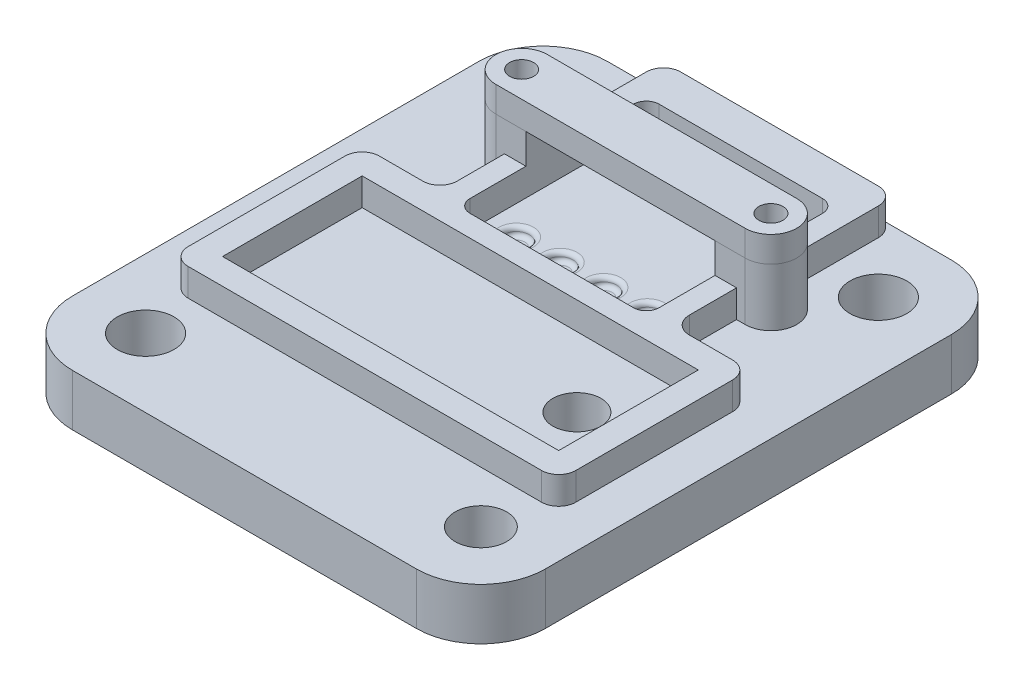
from build123d import *
from build123d.topology import SkipClean

# Parameters (mm, degrees)
SKETCH1_W              = 22.55
SKETCH1_H              = 11.12
SKETCH1_W_2            = 19.55
SKETCH1_H_2            = 8.12
BOSS_EXTRUDE1_DEPTH    = 1
SKETCH2_W              = 13.5
SKETCH2_H              = 13.5
SKETCH2_W_2            = 10.5
SKETCH2_H_2            = 10.5
BOSS_EXTRUDE2_DEPTH    = 1
SKETCH3_R              = 1.65
SKETCH3_R_2            = 1.5
SKETCH3_W              = 16.525
SKETCH3_H              = 8.12
SKETCH3_W_2            = 3.025
SKETCH3_W_3            = 10.5
SKETCH3_H_2            = 10.5
BOSS_EXTRUDE3_DEPTH    = 2
FILLET1_R              = 2.75
FILLET2_R              = 0.5
BOSS_EXTRUDE4_DEPTH    = 1
DELETEFACE1_DEPTH      = 1
SKETCH5_R              = 0.7
BOSS_EXTRUDE5_DEPTH    = 2.35
MOVE_START             = 1
MOVE_FACE1_OUTLINE_W   = 19.55
MOVE_FACE1_OUTLINE_H   = 8.12
MOVE_FACE1_DEPTH       = 0.6
SKETCH6_R              = 0.7
BOSS_EXTRUDE6_DEPTH    = 1.5
MOVE_FACE2_DEPTH       = 3.35
SKETCH7_R              = 1.5
CUT_EXTRUDE1_DEPTH     = 10
MOVE_FACE3_BY          = 0.1
MOVE_START_2           = -2
MOVE_FACE4_DEPTH       = 2
MOVE_FACE4_2_OUTLINE_W = 13.5
MOVE_FACE4_2_OUTLINE_H = 1
MOVE_FACE4_2_DEPTH     = 1.6
MOVE_START_3           = -3
MOVE_FACE5_OUTLINE_R   = 1.65
MOVE_FACE5_OUTLINE_R_2 = 1.5
MOVE_FACE5_OUTLINE_R_3 = 1.4
MOVE_FACE5_DEPTH       = 1
MOVE_START_4           = -1.5
MOVE_FACE6_OUTLINE_R   = 0.7
MOVE_FACE6_DEPTH       = 1.5
FILLET3_R              = 1
SKETCH8_R              = 0.75
CUT_EXTRUDE2_DEPTH     = 0.5
FILLET4_R              = 0.25


# Read off the part's stored shape, not the designer's step: DeleteFace1, Move Face1, Move Face2, Move Face4, Move Face5, Move Face6
# Some blends are built 0.0001 mm under size
with BuildPart() as part:
    # Sketch1 → Boss-Extrude1 (new body)
    with BuildSketch(Plane(origin=(0, 0, 0), x_dir=(1, 0, 0), z_dir=(0, 1, 0))):
        with Locations((9.525, 3.81)):
            Rectangle(SKETCH1_W, SKETCH1_H)
        with Locations((9.525, 3.81)):
            Rectangle(SKETCH1_W_2, SKETCH1_H_2, mode=Mode.SUBTRACT)
    extrude(amount=BOSS_EXTRUDE1_DEPTH)

    # Sketch2 → Boss-Extrude2 (add)
    with BuildSketch(Plane(origin=(0, 1, 0), x_dir=(1, 0, 0), z_dir=(0, 1, 0))):
        with Locations((9.525, 14.62)):
            Rectangle(SKETCH2_W, SKETCH2_H)
        with Locations((9.525, 14.62)):
            Rectangle(SKETCH2_W_2, SKETCH2_H_2, mode=Mode.SUBTRACT)
    extrude(amount=-BOSS_EXTRUDE2_DEPTH)

    # Sketch3 → Boss-Extrude3 (add)
    # profile 1 of 8: a face of its own
    with BuildSketch(Plane.XZ):
        with BuildLine():
            Line((-1.75, -9.37), (-1.75, 1.75))
            Line((-1.75, 1.75), (16.275, 1.75))
            Line((16.275, 1.75), (20.8, 1.75))
            Line((20.8, 1.75), (20.8, -9.37))
            Line((20.8, -9.37), (20.8, -17.74002))
            ThreePointArc((20.8, -17.74002), (20.893448, -18.048869), (20.925, -18.37))
            ThreePointArc((20.925, -18.37), (20.893448, -18.691131), (20.8, -18.99998))
            Line((20.8, -18.99998), (20.8, -21.37))
            Line((20.8, -21.37), (22.275, -21.37))
            Line((22.275, -21.37), (22.275, 7.75))
            Line((22.275, 7.75), (-3.225, 7.75))
            Line((-3.225, 7.75), (-3.225, -21.37))
            Line((-3.225, -21.37), (-1.75, -21.37))
            Line((-1.75, -21.37), (-1.75, -18.99998))
            ThreePointArc((-1.75, -18.99998), (-1.875, -18.37), (-1.75, -17.74002))
            Line((-1.75, -17.74002), (-1.75, -9.37))
        make_face()
        with Locations(Location((-0.225, 4.75, 0), (0, 0, 270))):
            Circle(SKETCH3_R, mode=Mode.SUBTRACT)
        with Locations(Location((19.275, 4.75, 0), (0, 0, 270))):
            Circle(SKETCH3_R_2, mode=Mode.SUBTRACT)
    # profile 2 of 8: a face of its own
    with BuildSketch(Plane.XZ):
        with Locations((8.0125, -3.81)):
            Rectangle(SKETCH3_W, SKETCH3_H)
    # profile 3 of 8: a face of its own
    with BuildSketch(Plane.XZ):
        Polygon((20.8, 1.75), (16.275, 1.75), (16.275, 0.25), (19.3, 0.25), (19.3, -7.87), (16.275, -7.87), (16.275, -9.37), (20.8, -9.37), align=None)
    # profile 4 of 8: a face of its own
    with BuildSketch(Plane.XZ):
        with Locations((17.7875, -3.81)):
            Rectangle(SKETCH3_W_2, SKETCH3_H)
    # profile 5 of 8: a face of its own
    with BuildSketch(Plane.XZ):
        with BuildLine():
            Line((2.775, -9.37), (-1.75, -9.37))
            Line((-1.75, -9.37), (-1.75, -17.74002))
            ThreePointArc((-1.75, -17.74002), (0.096131, -16.751552), (1.425, -18.37))
            ThreePointArc((1.425, -18.37), (0.096131, -19.988448), (-1.75, -18.99998))
            Line((-1.75, -18.99998), (-1.75, -21.37))
            Line((-1.75, -21.37), (2.775, -21.37))
            Line((2.775, -21.37), (2.775, -9.37))
        make_face()
    # profile 6 of 8: a face of its own
    with BuildSketch(Plane.XZ):
        Polygon((16.275, 1.75), (-1.75, 1.75), (-1.75, -9.37), (2.775, -9.37), (2.775, -21.37), (16.275, -21.37), (16.275, -9.37), (16.275, -7.87), (-0.25, -7.87), (-0.25, 0.25), (16.275, 0.25), align=None)
        with Locations((9.525, -14.62)):
            Rectangle(SKETCH3_W_3, SKETCH3_H_2, mode=Mode.SUBTRACT)
    # profile 7 of 8: a face of its own
    with BuildSketch(Plane.XZ):
        with Locations((9.525, -14.62)):
            Rectangle(SKETCH3_W_3, SKETCH3_H_2)
    # profile 8 of 8: a face of its own
    with BuildSketch(Plane.XZ):
        with BuildLine():
            Line((20.8, -17.74002), (20.8, -9.37))
            Line((20.8, -9.37), (16.275, -9.37))
            Line((16.275, -9.37), (16.275, -21.37))
            Line((16.275, -21.37), (20.8, -21.37))
            Line((20.8, -21.37), (20.8, -18.99998))
            ThreePointArc((20.8, -18.99998), (17.625, -18.37), (20.8, -17.74002))
        make_face()
    extrude(amount=BOSS_EXTRUDE3_DEPTH)

    # Fillet1
    fillet1_edges = [part.edges().sort_by_distance(p)[0] for p in [
        (-3.225, -1, 7.75),
        (-3.225, -1, -21.37),
        (22.275, -1, -21.37),
        (22.275, -1, 7.75),
    ]]
    fillet(fillet1_edges, radius=FILLET1_R)

    # Fillet2
    fillet2_edges = [part.edges().sort_by_distance(p)[0] for p in [
        (4.275, 0.5, -19.87),
        (14.775, 0.5, -19.87),
        (14.775, 0.5, -9.37),
        (4.275, 0.5, -9.37),
    ]]
    fillet(fillet2_edges, radius=FILLET2_R)

    # Sketch4 → Boss-Extrude4 (add)
    with BuildSketch(Plane(origin=(0, 0, 0), x_dir=(1, 0, 0), z_dir=(0, 1, 0))):
        with BuildLine():
            Line((16.275, 16.12), (16.275, 15.109898))
            ThreePointArc((16.275, 15.109898), (17.039575, 15.268074), (17.475, 14.62))
            ThreePointArc((17.475, 14.62), (17.039575, 13.971926), (16.275, 14.130102))
            Line((16.275, 14.130102), (16.275, 13.12))
            Line((16.275, 13.12), (16.775, 13.12))
            ThreePointArc((16.775, 13.12), (18.275, 14.62), (16.775, 16.12))
            Line((16.775, 16.12), (16.275, 16.12))
        make_face()
        with BuildLine():
            Line((2.775, 15.109898), (2.775, 16.12))
            Line((2.775, 16.12), (2.275, 16.12))
            ThreePointArc((2.275, 16.12), (0.775, 14.62), (2.275, 13.12))
            Line((2.275, 13.12), (2.775, 13.12))
            Line((2.775, 13.12), (2.775, 14.130102))
            ThreePointArc((2.775, 14.130102), (1.575, 14.62), (2.775, 15.109898))
        make_face()
    extrude(amount=BOSS_EXTRUDE4_DEPTH)

    # DeleteFace1 outline → DeleteFace1 (cut)
    with BuildSketch(Plane(origin=(0, 0, 0), x_dir=(1, 0, 0), z_dir=(0, 1, 0))):
        with BuildLine():
            ThreePointArc((2.775, 14.130102), (2.975, 14.62), (2.775, 15.109898))
            Line((2.775, 15.109898), (2.775, 14.130102))
        make_face()
        with BuildLine():
            Line((16.275, 14.130102), (16.275, 15.109898))
            ThreePointArc((16.275, 15.109898), (16.075, 14.62), (16.275, 14.130102))
        make_face()
    extrude(amount=DELETEFACE1_DEPTH, mode=Mode.SUBTRACT)

    # Sketch5 → Boss-Extrude5 (add)
    # profile 1 of 2: a face of its own
    with SkipClean():  # the faces are left unmerged after this step: merging them gives an invalid solid
        with BuildSketch(Plane(origin=(0, 1, 0), x_dir=(1, 0, 0), z_dir=(0, 1, 0))):
            with BuildLine():
                Line((4.275, 16.12), (4.275, 13.12))
                Line((4.275, 13.12), (2.275, 13.12))
                ThreePointArc((2.275, 13.12), (0.775, 14.62), (2.275, 16.12))
                Line((2.275, 16.12), (4.275, 16.12))
            make_face()
            with Locations(Location((2.275, 14.62, 0), (0, 0, 270))):
                Circle(SKETCH5_R, mode=Mode.SUBTRACT)
        # profile 2 of 2: a face of its own
        with BuildSketch(Plane(origin=(0, 1, 0), x_dir=(1, 0, 0), z_dir=(0, 1, 0))):
            with BuildLine():
                Line((14.775, 13.12), (14.775, 16.12))
                Line((14.775, 16.12), (16.775, 16.12))
                ThreePointArc((16.775, 16.12), (18.275, 14.62), (16.775, 13.12))
                Line((16.775, 13.12), (14.775, 13.12))
            make_face()
            with Locations(Location((16.775, 14.62, 0), (0, 0, 270))):
                Circle(SKETCH5_R, mode=Mode.SUBTRACT)
        extrude(amount=BOSS_EXTRUDE5_DEPTH)

    # Move Face1 outline → Move Face1 (add)
    # profile 1 of 2: a face of its own
    with SkipClean():  # the faces are left unmerged after this step: merging them gives an invalid solid
        with BuildSketch(Plane(origin=(0, 0, 0), x_dir=(1, 0, 0), z_dir=(0, 1, 0)).offset(MOVE_START)):
            with BuildLine():
                Line((14.775, 16.12), (16.275, 16.12))
                Line((16.275, 16.12), (16.275, 21.37))
                Line((16.275, 21.37), (2.775, 21.37))
                Line((2.775, 21.37), (2.775, 16.12))
                Line((2.775, 16.12), (4.275, 16.12))
                Line((4.275, 16.12), (4.275, 19.37))
                ThreePointArc((4.275, 19.37), (4.421447, 19.723553), (4.775, 19.87))
                Line((4.775, 19.87), (14.275, 19.87))
                ThreePointArc((14.275, 19.87), (14.628553, 19.723553), (14.775, 19.37))
                Line((14.775, 19.37), (14.775, 16.12))
            make_face()
        # profile 2 of 2: a face of its own
        with BuildSketch(Plane(origin=(0, 0, 0), x_dir=(1, 0, 0), z_dir=(0, 1, 0)).offset(MOVE_START)):
            with BuildLine():
                Line((16.275, 13.12), (14.775, 13.12))
                Line((14.775, 13.12), (14.775, 9.87))
                ThreePointArc((14.775, 9.87), (14.628553, 9.516447), (14.275, 9.37))
                Line((14.275, 9.37), (4.775, 9.37))
                ThreePointArc((4.775, 9.37), (4.421447, 9.516447), (4.275, 9.87))
                Line((4.275, 9.87), (4.275, 13.12))
                Line((4.275, 13.12), (2.775, 13.12))
                Line((2.775, 13.12), (2.775, 9.37))
                Line((2.775, 9.37), (-1.75, 9.37))
                Line((-1.75, 9.37), (-1.75, -1.75))
                Line((-1.75, -1.75), (20.8, -1.75))
                Line((20.8, -1.75), (20.8, 9.37))
                Line((20.8, 9.37), (16.275, 9.37))
                Line((16.275, 9.37), (16.275, 13.12))
            make_face()
            with Locations((9.525, 3.81)):
                Rectangle(MOVE_FACE1_OUTLINE_W, MOVE_FACE1_OUTLINE_H, mode=Mode.SUBTRACT)
        extrude(amount=MOVE_FACE1_DEPTH)

    # Move Face2 outline → Move Face2 (cut)
    with SkipClean():  # the faces are left unmerged after this step: merging them gives an invalid solid
        with BuildSketch(Plane(origin=(0, 0, 0), x_dir=(1, 0, 0), z_dir=(0, 1, 0))):
            with BuildLine():
                Line((4.775, 9.12), (14.275, 9.12))
                ThreePointArc((14.275, 9.12), (14.80533, 9.33967), (15.025, 9.87))
                Line((15.025, 9.87), (15.025, 19.37))
                ThreePointArc((15.025, 19.37), (14.80533, 19.90033), (14.275, 20.12))
                Line((14.275, 20.12), (4.775, 20.12))
                ThreePointArc((4.775, 20.12), (4.24467, 19.90033), (4.025, 19.37))
                Line((4.025, 19.37), (4.025, 9.87))
                ThreePointArc((4.025, 9.87), (4.24467, 9.33967), (4.775, 9.12))
            make_face()
            with BuildLine():
                Line((4.275, 9.87), (4.275, 19.37))
                ThreePointArc((4.275, 19.37), (4.421447, 19.723553), (4.775, 19.87))
                Line((4.775, 19.87), (14.275, 19.87))
                ThreePointArc((14.275, 19.87), (14.628553, 19.723553), (14.775, 19.37))
                Line((14.775, 19.37), (14.775, 9.87))
                ThreePointArc((14.775, 9.87), (14.628553, 9.516447), (14.275, 9.37))
                Line((14.275, 9.37), (4.775, 9.37))
                ThreePointArc((4.775, 9.37), (4.421447, 9.516447), (4.275, 9.87))
            make_face(mode=Mode.SUBTRACT)
        extrude(amount=MOVE_FACE2_DEPTH, mode=Mode.SUBTRACT)

    # Sketch7 → Cut-Extrude1 (cut)
    with SkipClean():  # the faces are left unmerged after this step: merging them gives an invalid solid
        with BuildSketch(Plane(origin=(0, 0, 0), x_dir=(1, 0, 0), z_dir=(0, 1, 0))):
            with Locations(Location((16.3, 3.81, 0), (0, 0, 270))):
                Circle(SKETCH7_R)
        extrude(amount=-CUT_EXTRUDE1_DEPTH, mode=Mode.SUBTRACT)

    # Move Face3: a curved face moved outward by 0.1
    add(Solid.thicken(part.faces().sort_by_distance((16.3, -1, -5.31))[0], MOVE_FACE3_BY))

    # Move Face4 outline → Move Face4 (add)
    with SkipClean():  # the faces are left unmerged after this step: merging them gives an invalid solid
        with BuildSketch(Plane(origin=(0, 0, 0), x_dir=(1, 0, 0), z_dir=(0, 1, 0)).offset(MOVE_START_2)):
            with BuildLine():
                ThreePointArc((-0.475, 22.37), (-3.12665, 21.27165), (-4.225, 18.62))
                Line((-4.225, 18.62), (-4.225, -5))
                ThreePointArc((-4.225, -5), (-3.12665, -7.65165), (-0.475, -8.75))
                Line((-0.475, -8.75), (19.525, -8.75))
                ThreePointArc((19.525, -8.75), (22.17665, -7.65165), (23.275, -5))
                Line((23.275, -5), (23.275, 18.62))
                ThreePointArc((23.275, 18.62), (22.17665, 21.27165), (19.525, 22.37))
                Line((19.525, 22.37), (-0.475, 22.37))
            make_face()
            with BuildLine():
                ThreePointArc((19.525, 21.37), (21.469544, 20.564544), (22.275, 18.62))
                Line((22.275, 18.62), (22.275, -5))
                ThreePointArc((22.275, -5), (21.469544, -6.944544), (19.525, -7.75))
                Line((19.525, -7.75), (-0.475, -7.75))
                ThreePointArc((-0.475, -7.75), (-2.419544, -6.944544), (-3.225, -5))
                Line((-3.225, -5), (-3.225, 18.62))
                ThreePointArc((-3.225, 18.62), (-2.419544, 20.564544), (-0.475, 21.37))
                Line((-0.475, 21.37), (19.525, 21.37))
            make_face(mode=Mode.SUBTRACT)
        extrude(amount=MOVE_FACE4_DEPTH)

    # Move Face4 2 outline → Move Face4 2 (add)
    with SkipClean():  # the faces are left unmerged after this step: merging them gives an invalid solid
        with BuildSketch(Plane(origin=(0, 0, 0), x_dir=(1, 0, 0), z_dir=(0, 1, 0))):
            with Locations((9.525, 21.87)):
                Rectangle(MOVE_FACE4_2_OUTLINE_W, MOVE_FACE4_2_OUTLINE_H)
        extrude(amount=MOVE_FACE4_2_DEPTH)

    # Move Face5 outline → Move Face5 (add)
    with SkipClean():  # the faces are left unmerged after this step: merging them gives an invalid solid
        with BuildSketch(Plane(origin=(0, 0, 0), x_dir=(1, 0, 0), z_dir=(0, 1, 0)).offset(MOVE_START_3)):
            with BuildLine():
                ThreePointArc((23.275, 18.62), (22.17665, 21.27165), (19.525, 22.37))
                Line((19.525, 22.37), (-0.475, 22.37))
                ThreePointArc((-0.475, 22.37), (-3.12665, 21.27165), (-4.225, 18.62))
                Line((-4.225, 18.62), (-4.225, -5))
                ThreePointArc((-4.225, -5), (-3.12665, -7.65165), (-0.475, -8.75))
                Line((-0.475, -8.75), (19.525, -8.75))
                ThreePointArc((19.525, -8.75), (22.17665, -7.65165), (23.275, -5))
                Line((23.275, -5), (23.275, 18.62))
            make_face()
            with Locations((-0.225, -4.75)):
                Circle(MOVE_FACE5_OUTLINE_R, mode=Mode.SUBTRACT)
            with Locations((19.275, -4.75)):
                Circle(MOVE_FACE5_OUTLINE_R_2, mode=Mode.SUBTRACT)
            with Locations((16.3, 3.81)):
                Circle(MOVE_FACE5_OUTLINE_R_3, mode=Mode.SUBTRACT)
            with Locations((-0.225, 18.37)):
                Circle(MOVE_FACE5_OUTLINE_R, mode=Mode.SUBTRACT)
            with Locations((19.275, 18.37)):
                Circle(MOVE_FACE5_OUTLINE_R, mode=Mode.SUBTRACT)
        extrude(amount=MOVE_FACE5_DEPTH)

    # Move Face6 outline → Move Face6 (cut)
    with SkipClean():  # the faces are left unmerged after this step: merging them gives an invalid solid
        with BuildSketch(Plane(origin=(0, 0, 0), x_dir=(1, 0, 0), z_dir=(0, 1, 0)).offset(MOVE_START_4)):
            with Locations((16.775, 14.62)):
                Circle(MOVE_FACE6_OUTLINE_R)
            with Locations((2.275, 14.62)):
                Circle(MOVE_FACE6_OUTLINE_R)
        extrude(amount=MOVE_FACE6_DEPTH, mode=Mode.SUBTRACT)

    # Fillet3
    # the kernel refuses this fillet: 1 mm, written as the material it adds along each edge
    with BuildSketch(Plane(origin=(2.775, -2.5, -9.37), x_dir=(-1, 0, 0), z_dir=(0, 1, 0)), Plane(origin=(16.275, 1, -9.37), x_dir=(1, 0, 0), z_dir=(0, -1, 0))) as fillet3_piece_1:
        with BuildLine():
            CenterArc((FILLET3_R, -FILLET3_R), FILLET3_R, 90, 90)
            Line((0, -FILLET3_R), (0, 0))
            Line((0, 0), (FILLET3_R, 0))
        make_face()
    extrude(amount=3.5)
    with BuildSketch(Plane(origin=(16.275, 1, -9.37), x_dir=(1, 0, 0), z_dir=(0, 1, 0))) as fillet3_piece_2:
        with BuildLine():
            CenterArc((FILLET3_R, FILLET3_R), FILLET3_R, 180, 90)
            Line((0, FILLET3_R), (0, 0))
            Line((0, 0), (FILLET3_R, 0))
        make_face()
    extrude(amount=0.6)
    with BuildSketch(Plane(origin=(2.775, 1, -9.37), x_dir=(-1, 0, 0), z_dir=(0, 1, 0))) as fillet3_piece_3:
        with BuildLine():
            CenterArc((FILLET3_R, -FILLET3_R), FILLET3_R, 90, 90)
            Line((0, -FILLET3_R), (0, 0))
            Line((0, 0), (FILLET3_R, 0))
        make_face()
    extrude(amount=0.6)
    # the kernel refuses this fillet: 1 mm, written as the material it takes off along each edge
    with BuildSketch(Plane(origin=(-1.75, 0, -9.37), x_dir=(0, 0, 1), z_dir=(0, 1, 0)), Plane(origin=(20.8, 0, 1.75), x_dir=(0, 0, -1), z_dir=(0, 1, 0)), Plane(origin=(-1.75, 0, 1.75), x_dir=(1, 0, 0), z_dir=(0, 1, 0))) as fillet3_2_piece_1:
        with BuildLine():
            CenterArc((FILLET3_R, FILLET3_R), FILLET3_R, 180, 90)
            Line((0, FILLET3_R), (0, 0))
            Line((0, 0), (FILLET3_R, 0))
        make_face()
    extrude(amount=1, mode=Mode.SUBTRACT)
    with BuildSketch(Plane(origin=(20.8, 0, -9.37), x_dir=(0, 0, 1), z_dir=(0, 1, 0))) as fillet3_2_piece_2:
        with BuildLine():
            CenterArc((FILLET3_R, -FILLET3_R), FILLET3_R, 90, 90)
            Line((0, -FILLET3_R), (0, 0))
            Line((0, 0), (FILLET3_R, 0))
        make_face()
    extrude(amount=1, mode=Mode.SUBTRACT)
    with BuildSketch(Plane(origin=(2.775, 0, -22.37), x_dir=(0, 0, 1), z_dir=(0, 1, 0))) as fillet3_2_piece_3:
        with BuildLine():
            CenterArc((FILLET3_R, FILLET3_R), FILLET3_R, 180, 90)
            Line((0, FILLET3_R), (0, 0))
            Line((0, 0), (FILLET3_R, 0))
        make_face()
    extrude(amount=4.1, mode=Mode.SUBTRACT)
    with BuildSketch(Plane(origin=(16.275, 0, -22.37), x_dir=(0, 0, 1), z_dir=(0, 1, 0))) as fillet3_2_piece_4:
        with BuildLine():
            CenterArc((FILLET3_R, -FILLET3_R), FILLET3_R, 90, 90)
            Line((0, -FILLET3_R), (0, 0))
            Line((0, 0), (FILLET3_R, 0))
        make_face()
    extrude(amount=4.1, mode=Mode.SUBTRACT)
    with BuildSketch(Plane(origin=(-1.75, 1, 1.75), x_dir=(1, 0, 0), z_dir=(0, 1, 0)), Plane(origin=(20.8, 1, 1.75), x_dir=(0, 0, -1), z_dir=(0, 1, 0)), Plane(origin=(-1.75, 1, -9.37), x_dir=(0, 0, 1), z_dir=(0, 1, 0))) as fillet3_2_piece_5:
        with BuildLine():
            CenterArc((FILLET3_R, FILLET3_R), FILLET3_R, 180, 90)
            Line((0, FILLET3_R), (0, 0))
            Line((0, 0), (FILLET3_R, 0))
        make_face()
    extrude(amount=3.1, mode=Mode.SUBTRACT)
    with BuildSketch(Plane(origin=(20.8, 1, -9.37), x_dir=(0, 0, 1), z_dir=(0, 1, 0))) as fillet3_2_piece_6:
        with BuildLine():
            CenterArc((FILLET3_R, -FILLET3_R), FILLET3_R, 90, 90)
            Line((0, -FILLET3_R), (0, 0))
            Line((0, 0), (FILLET3_R, 0))
        make_face()
    extrude(amount=3.1, mode=Mode.SUBTRACT)

    # Sketch8 → Cut-Extrude2 (cut)
    with BuildSketch(Plane(origin=(0, 0, 0), x_dir=(1, 0, 0), z_dir=(0, 1, 0))):
        with Locations(Location((5.715, 18.37, 0), (0, 0, 270))):
            Circle(SKETCH8_R)
        with Locations(Location((13.335, 18.37, 0), (0, 0, 270))):
            Circle(SKETCH8_R)
        with Locations(Location((13.335, 10.87, 0), (0, 0, 270))):
            Circle(SKETCH8_R)
        with Locations(Location((10.795, 10.87, 0), (0, 0, 270))):
            Circle(SKETCH8_R)
        with Locations(Location((8.255, 10.87, 0), (0, 0, 270))):
            Circle(SKETCH8_R)
        with Locations(Location((5.715, 10.87, 0), (0, 0, 270))):
            Circle(SKETCH8_R)
        with Locations(Location((8.255, 18.37, 0), (0, 0, 270))):
            Circle(SKETCH8_R)
        with Locations(Location((10.795, 18.37, 0), (0, 0, 270))):
            Circle(SKETCH8_R)
    extrude(amount=-CUT_EXTRUDE2_DEPTH, mode=Mode.SUBTRACT)

    # Fillet4
    fillet4_edges = [part.edges().sort_by_distance(p)[0] for p in [
        (13.335, -0.5, -19.12),
        (13.335, 0, -19.12),
        (13.335, -0.5, -11.62),
        (13.335, 0, -11.62),
        (10.795, -0.5, -11.62),
        (10.795, 0, -11.62),
        (8.255, -0.5, -11.62),
        (8.255, 0, -11.62),
        (5.715, -0.5, -11.62),
        (5.715, 0, -11.62),
        (8.255, -0.5, -19.12),
        (8.255, 0, -19.12),
        (10.795, -0.5, -19.12),
        (10.795, 0, -19.12),
        (5.715, -0.5, -19.12),
        (5.715, 0, -19.12),
    ]]
    fillet(fillet4_edges, radius=FILLET4_R - 0.0001)  # a hair under: the kernel refuses the full size


with BuildPart() as body_2:
    # Sketch6 → Boss-Extrude6 (new body)
    with BuildSketch(Plane(origin=(0, 3.35, 0), x_dir=(1, 0, 0), z_dir=(0, 1, 0))):
        with BuildLine():
            Line((4.275, 16.12), (14.775, 16.12))
            Line((14.775, 16.12), (16.775, 16.12))
            ThreePointArc((16.775, 16.12), (18.275, 14.62), (16.775, 13.12))
            Line((16.775, 13.12), (14.775, 13.12))
            Line((14.775, 13.12), (4.275, 13.12))
            Line((4.275, 13.12), (2.275, 13.12))
            ThreePointArc((2.275, 13.12), (0.775, 14.62), (2.275, 16.12))
            Line((2.275, 16.12), (4.275, 16.12))
        make_face()
        with Locations(Location((16.775, 14.62, 0), (0, 0, 270))):
            Circle(SKETCH6_R, mode=Mode.SUBTRACT)
        with Locations(Location((2.275, 14.62, 0), (0, 0, 270))):
            Circle(SKETCH6_R, mode=Mode.SUBTRACT)
    extrude(amount=BOSS_EXTRUDE6_DEPTH)


solid = Compound([part.part, body_2.part])
